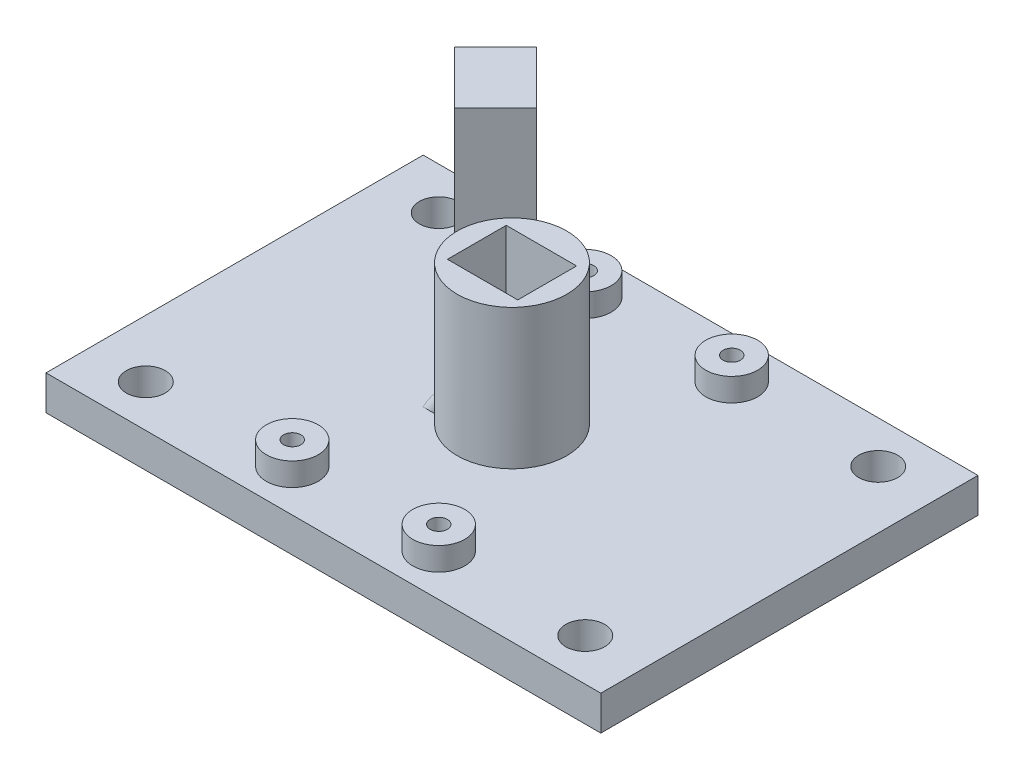
from build123d import *

# Parameters (mm, degrees)
SKETCH2_R                 = 1.5000000000000042
SKETCH2_R_2               = 1.4999999999999973
SKETCH2_R_3               = 3.37343749999996
BOSS_EXTRUDE1_DEPTH       = 6
SKETCH3_R                 = 4.500000000000005
SKETCH3_R_2               = 1.4999999999999973
BOSS_EXTRUDE2_DEPTH       = 4
MIRROR2_COPY_1_SKETCH_R   = 4.500000000000005
MIRROR2_COPY_1_SKETCH_R_2 = 1.4999999999999973
MIRROR2_COPY_1_DEPTH      = 4
BOSS_EXTRUDE3_DEPTH       = 14
CUT_EXTRUDE2_START        = -3
CUT_EXTRUDE2_DEPTH        = 3
SKETCH8_W                 = 7.5
SKETCH8_H                 = 1.5
BOSS_EXTRUDE4_DEPTH       = 3
BOSS_EXTRUDE5_START       = -12.000000000000004
BOSS_EXTRUDE5_DEPTH       = 12.000000000000004
SKETCH10_R                = 9.499999999999993
SKETCH10_W                = 12.200000000000003
SKETCH10_H                = 10.200000000000003
BOSS_EXTRUDE6_DEPTH       = 10.25
FILLET1_R                 = 2
BOSS_EXTRUDE7_DEPTH       = 3
BOSS_EXTRUDE8_DEPTH       = 2
BOSS_EXTRUDE9_DEPTH       = 11
BOSS_EXTRUDE10_DEPTH      = 2
BOSS_EXTRUDE11_DEPTH      = 2
BOSS_EXTRUDE12_DEPTH      = 11
BOSS_EXTRUDE13_DEPTH      = 2


with BuildPart() as part:
    # Sketch2 → Boss-Extrude1 (new body)
    with BuildSketch(Plane(origin=(0, 0, 0), x_dir=(1, 0, 0), z_dir=(0, 1, 0))):
        Polygon((118.7318886716207, 32.455394598369764), (118.73188867162068, 97.85539459836978), (22.531888671620678, 97.85539459836976), (22.5318886716207, 32.45539459836975), align=None)
        with Locations(Location((57.93188867162069, 39.75539459836976, 0), (0, 0, 270))):
            Circle(SKETCH2_R, mode=Mode.SUBTRACT)
        with Locations(Location((83.3318886716207, 39.75539459836976, 0), (0, 0, 270))):
            Circle(SKETCH2_R_2, mode=Mode.SUBTRACT)
        with Locations(Location((57.931888671620705, 90.55539459836976, 0), (0, 0, 270))):
            Circle(SKETCH2_R_2, mode=Mode.SUBTRACT)
        with Locations(Location((83.3318886716207, 90.55539459836974, 0), (0, 0, 270))):
            Circle(SKETCH2_R_2, mode=Mode.SUBTRACT)
        with Locations(Location((108.7318886716207, 90.55539459836974, 0), (0, 0, 270))):
            Circle(SKETCH2_R_3, mode=Mode.SUBTRACT)
        with Locations(Location((108.73188867162068, 39.755394598369776, 0), (0, 0, 270))):
            Circle(SKETCH2_R_3, mode=Mode.SUBTRACT)
        with Locations(Location((32.53188867162068, 90.55539459836974, 0), (0, 0, 270))):
            Circle(SKETCH2_R_3, mode=Mode.SUBTRACT)
        with Locations(Location((32.53188867162071, 39.755394598369755, 0), (0, 0, 270))):
            Circle(SKETCH2_R_3, mode=Mode.SUBTRACT)
    extrude(amount=BOSS_EXTRUDE1_DEPTH)

    # Sketch3 → Boss-Extrude2 (add)
    with BuildSketch(Plane(origin=(0, 6, 0), x_dir=(1, 0, 0), z_dir=(0, 1, 0))):
        with Locations(Location((83.3318886716207, 39.75539459836976, 0), (0, 0, 270))):
            Circle(SKETCH3_R)
        with Locations(Location((83.3318886716207, 39.75539459836976, 0), (0, 0, 270))):
            Circle(SKETCH3_R_2, mode=Mode.SUBTRACT)
    boss_extrude2 = extrude(amount=BOSS_EXTRUDE2_DEPTH)

    # Mirror1: Boss-Extrude2 across plane
    add(boss_extrude2.mirror(Plane.ZY.offset(-70.6318886716207)))

    # Mirror2: Boss-Extrude2 across plane
    add(boss_extrude2.mirror(Plane(origin=(-1.41e-14, 0, -65.15539459836975), x_dir=(1, 0, -1e-16), z_dir=(-1e-16, 0, -1))))

    # Mirror2 copy 1 sketch → Mirror2 copy 1 (add)
    with BuildSketch(Plane(origin=(141.2637773432414, 6, -130.31078919673953), x_dir=(-1, 0, 2.1e-16), z_dir=(0, 1, 0))):
        with Locations(Location((83.3318886716207, 39.75539459836976, 0), (0, 0, 270))):
            Circle(MIRROR2_COPY_1_SKETCH_R)
        with Locations(Location((83.3318886716207, 39.75539459836976, 0), (0, 0, 270))):
            Circle(MIRROR2_COPY_1_SKETCH_R_2, mode=Mode.SUBTRACT)
    extrude(amount=MIRROR2_COPY_1_DEPTH)

    # Sketch6 → Boss-Extrude3 (add)
    with BuildSketch(Plane(origin=(0, 6, 0), x_dir=(1, 0, 0), z_dir=(0, 1, 0))):
        with BuildLine():
            Line((66.88188867162067, 70.27984578849734), (74.38188867162069, 70.27984578849734))
            ThreePointArc((74.38188867162069, 70.27984578849734), (70.63188867162069, 71.50539459836976), (66.88188867162067, 70.27984578849734))
        make_face()
        with BuildLine():
            ThreePointArc((66.88188867162067, 70.27984578849734), (70.63188867162069, 71.50539459836976), (74.38188867162069, 70.27984578849734))
            ThreePointArc((74.38188867162069, 70.27984578849734), (76.29470599164787, 68.02854617808148), (76.98188867162068, 65.15539459836977))
            ThreePointArc((76.98188867162068, 65.15539459836977), (76.29470599164787, 62.282243018658036), (74.38188867162067, 60.03094340824218))
            ThreePointArc((74.38188867162067, 60.03094340824218), (70.63188867162069, 58.80539459836977), (66.88188867162069, 60.03094340824219))
            Line((66.88188867162069, 60.03094340824217), (62.63251369603666, 60.03094340824217))
            ThreePointArc((62.63251369603667, 60.03094340824218), (73.30171429625909, 56.038266150551124), (80.13188867162069, 65.15539459836977))
            ThreePointArc((80.13188867162069, 65.15539459836977), (73.30171429625909, 74.27252304618841), (62.63251369603665, 70.27984578849734))
            Line((62.632513696036646, 70.27984578849734), (66.88188867162067, 70.27984578849734))
        make_face()
        with BuildLine():
            Line((74.38188867162069, 60.03094340824217), (66.88188867162069, 60.03094340824217))
            ThreePointArc((66.88188867162069, 60.03094340824219), (70.63188867162069, 58.80539459836977), (74.38188867162067, 60.03094340824218))
        make_face()
    extrude(amount=BOSS_EXTRUDE3_DEPTH)

    # Sketch12 → Cut-Extrude2 (cut)
    with BuildSketch(Plane(origin=(0, 6, 0), x_dir=(1, 0, 0), z_dir=(0, 1, 0)).offset(CUT_EXTRUDE2_START)):
        with BuildLine():
            Line((62.63251369603666, 60.03094340824217), (66.88188867162044, 60.03094340824217))
            ThreePointArc((66.88188867162049, 60.03094340824234), (64.28188867162069, 65.15539459836975), (66.88188867162047, 70.27984578849718))
            Line((66.88188867162042, 70.27984578849734), (62.632513696036646, 70.27984578849734))
            ThreePointArc((62.63251369603664, 70.27984578849734), (61.13188867162067, 65.15539459836975), (62.63251369603665, 60.030943408242166))
        make_face()
        with BuildLine():
            Line((66.88188867162044, 60.03094340824217), (74.38188867162069, 60.03094340824218))
            ThreePointArc((74.38188867162069, 60.03094340824219), (76.29470599164789, 62.282243018658036), (76.9818886716207, 65.15539459836977))
            ThreePointArc((76.9818886716207, 65.15539459836977), (76.29470599164789, 68.0285461780815), (74.38188867162069, 70.27984578849734))
            Line((74.38188867162069, 70.27984578849734), (66.88188867162042, 70.27984578849734))
            ThreePointArc((66.88188867162047, 70.27984578849718), (64.28188867162069, 65.15539459836975), (66.88188867162049, 60.03094340824234))
        make_face()
    extrude(amount=CUT_EXTRUDE2_DEPTH, mode=Mode.SUBTRACT)

    # Sketch8 → Boss-Extrude4 (add)
    with BuildSketch(Plane(origin=(0, 3, 0), x_dir=(1, 0, 0), z_dir=(0, 1, 0))):
        with Locations((70.63188867162069, 69.40539459836977)):
            Rectangle(SKETCH8_W, SKETCH8_H)
        with Locations((70.63188867162069, 60.90539459836977)):
            Rectangle(SKETCH8_W, SKETCH8_H)
    extrude(amount=BOSS_EXTRUDE4_DEPTH)

    # Sketch9 → Boss-Extrude5 (add)
    with BuildSketch(Plane(origin=(0, 20, 0), x_dir=(1, 0, 0), z_dir=(0, 1, 0)).offset(BOSS_EXTRUDE5_START)):
        with BuildLine():
            ThreePointArc((80.1318886716207, 65.15539459836977), (73.30171429625909, 74.27252304618843), (62.632513696036646, 70.27984578849735))
            Line((62.632513696036646, 70.27984578849734), (66.88188867162042, 70.27984578849734))
            ThreePointArc((66.88188867162047, 70.27984578849718), (70.63188867162056, 71.50539459836976), (74.38188867162069, 70.27984578849734))
            ThreePointArc((74.38188867162069, 70.27984578849734), (76.29470599164787, 68.02854617808148), (76.98188867162068, 65.15539459836977))
            ThreePointArc((76.98188867162068, 65.15539459836977), (76.29470599164787, 62.282243018658036), (74.38188867162069, 60.03094340824219))
            ThreePointArc((74.38188867162069, 60.03094340824219), (70.63188867162056, 58.80539459836977), (66.88188867162049, 60.03094340824234))
            Line((66.88188867162044, 60.03094340824217), (62.63251369603666, 60.03094340824217))
            ThreePointArc((62.63251369603665, 60.030943408242166), (73.3017142962591, 56.03826615055111), (80.1318886716207, 65.15539459836977))
        make_face()
        with BuildLine():
            Line((66.88188867162042, 70.27984578849734), (62.632513696036646, 70.27984578849734))
            ThreePointArc((62.632513696036646, 70.27984578849735), (61.13188867162067, 65.15539459836975), (62.63251369603665, 60.030943408242166))
            Line((62.63251369603666, 60.03094340824217), (66.88188867162044, 60.03094340824217))
            ThreePointArc((66.88188867162049, 60.03094340824234), (64.28188867162069, 65.15539459836975), (66.88188867162047, 70.27984578849718))
        make_face()
    extrude(amount=BOSS_EXTRUDE5_DEPTH)

    # Sketch10 → Boss-Extrude6 (add)
    with BuildSketch(Plane(origin=(0, 20, 0), x_dir=(1, 0, 0), z_dir=(0, 1, 0))):
        with Locations(Location((70.63188867162069, 65.15539459836977, 0), (0, 0, 147.35611352))):
            Circle(SKETCH10_R)
        with Locations((70.63188867162069, 65.15539459836975)):
            Rectangle(SKETCH10_W, SKETCH10_H, mode=Mode.SUBTRACT)
    extrude(amount=BOSS_EXTRUDE6_DEPTH)

    # Fillet1
    # the kernel refuses this fillet: 2 mm, written as the material it takes off along each edge
    with BuildSketch(Plane(origin=(70.63188867162066, 6, -65.15539459836977), x_dir=(-0.45700581372795496, 0, -0.8894637070835716), z_dir=(0.8894637070835716, 0, -0.45700581372795496))) as fillet1_piece_1_section:
        with BuildLine():
            CenterArc((9.500000000000403 + FILLET1_R, -FILLET1_R), FILLET1_R, 90, 90)
            Line((9.500000000000403, -FILLET1_R), (9.500000000000403, 0))
            Line((9.500000000000403, 0), (9.500000000000403 + FILLET1_R, 0))
        make_face()
    fillet1_piece_1 = revolve(axis=Axis((70.63188867162066, 6, -65.15539459836977), (0, 1, 0)), revolution_arc=125.61186747806521, mode=Mode.PRIVATE)
    fillet1_piece_1 = split(fillet1_piece_1, bisect_by=Plane(origin=(60.560942859837816, 5.429054188217563, -70.27984578849734), z_dir=(0, 0, 1)), keep=Keep.TOP, mode=Mode.PRIVATE)
    fillet1_piece_1 = split(fillet1_piece_1, bisect_by=Plane(origin=(60.560942859837816, 5.429054188217563, -60.03094340824217), z_dir=(0, 0, -1)), keep=Keep.TOP, mode=Mode.PRIVATE)
    add(fillet1_piece_1, mode=Mode.SUBTRACT)

    # Sketch13 → Boss-Extrude7 (add)
    with BuildSketch(Plane(origin=(0, 6, 0), x_dir=(1, 0, 0), z_dir=(0, 1, 0))):
        Polygon((51.21437425034851, 74.64549202167245), (58.285442062214, 81.71655983353793), (49.0930539067889, 90.90894798896305), (42.0219860949234, 83.83788017709759), align=None)
    extrude(amount=BOSS_EXTRUDE7_DEPTH)

    # Sketch14 → Boss-Extrude8 (add)
    with BuildSketch(Plane(origin=(0, 9.000000000000002, 0), x_dir=(1, 0, 0), z_dir=(0, 1, 0))):
        Polygon((42.0219860949234, 83.83788017709759), (44.160984108012705, 81.69888216400828), (49.817838357505074, 87.35573641350065), (54.73223048675158, 82.44134428425414), (49.07537623725921, 76.78449003476177), (51.21437425034851, 74.64549202167245), (58.285442062213995, 81.71655983353793), (49.0930539067889, 90.90894798896305), align=None)
    extrude(amount=BOSS_EXTRUDE8_DEPTH)

    # Sketch15 → Boss-Extrude9 (add)
    with BuildSketch(Plane(origin=(0, 11.000000000000002, 0), x_dir=(1, 0, 0), z_dir=(0, 1, 0))):
        Polygon((44.16098410801271, 81.69888216400828), (49.81783835750507, 87.35573641350065), (51.2320519198782, 88.76994997587377), (49.09305390678893, 90.90894798896306), (42.0219860949234, 83.83788017709759), align=None)
        Polygon((56.14644404912469, 83.85555784662725), (54.732230486751575, 82.44134428425414), (49.0753762372592, 76.78449003476176), (51.21437425034851, 74.64549202167245), (58.285442062213995, 81.71655983353793), align=None)
    extrude(amount=BOSS_EXTRUDE9_DEPTH)

    # Sketch16 → Boss-Extrude10 (add)
    with BuildSketch(Plane(origin=(0, 22, 0), x_dir=(1, 0, 0), z_dir=(0, 1, 0))):
        Polygon((42.0219860949234, 83.83788017709759), (51.21437425034852, 74.64549202167245), (58.285442062213995, 81.71655983353793), (49.093053906788946, 90.90894798896309), align=None)
    extrude(amount=BOSS_EXTRUDE10_DEPTH)

    # Sketch17 → Boss-Extrude11 (add)
    with BuildSketch(Plane(origin=(0, 24, 0), x_dir=(1, 0, 0), z_dir=(0, 1, 0))):
        Polygon((49.81783835750507, 87.35573641350065), (54.732230486751575, 82.44134428425414), (49.0753762372592, 76.78449003476176), (51.21437425034852, 74.64549202167245), (58.285442062213995, 81.71655983353793), (49.093053906788946, 90.90894798896309), (42.0219860949234, 83.83788017709759), (44.160984108012705, 81.69888216400828), align=None)
    extrude(amount=BOSS_EXTRUDE11_DEPTH)

    # Sketch18 → Boss-Extrude12 (add)
    with BuildSketch(Plane(origin=(0, 26.000000000000004, 0), x_dir=(1, 0, 0), z_dir=(0, 1, 0))):
        Polygon((44.16098410801272, 81.69888216400828), (49.81783835750507, 87.35573641350065), (51.23205191987821, 88.76994997587379), (49.093053906788946, 90.90894798896306), (42.0219860949234, 83.83788017709759), align=None)
        Polygon((56.146444049124675, 83.85555784662725), (54.73223048675157, 82.44134428425414), (49.07537623725922, 76.78449003476177), (51.21437425034852, 74.64549202167245), (58.285442062213974, 81.71655983353793), align=None)
    extrude(amount=BOSS_EXTRUDE12_DEPTH)

    # Sketch19 → Boss-Extrude13 (add)
    with BuildSketch(Plane(origin=(0, 37.00000000000001, 0), x_dir=(1, 0, 0), z_dir=(0, 1, 0))):
        Polygon((42.0219860949234, 83.83788017709759), (51.214374250348534, 74.64549202167247), (58.285442062213946, 81.71655983353793), (49.09305390678893, 90.90894798896309), align=None)
    extrude(amount=BOSS_EXTRUDE13_DEPTH)


solid = part.part
